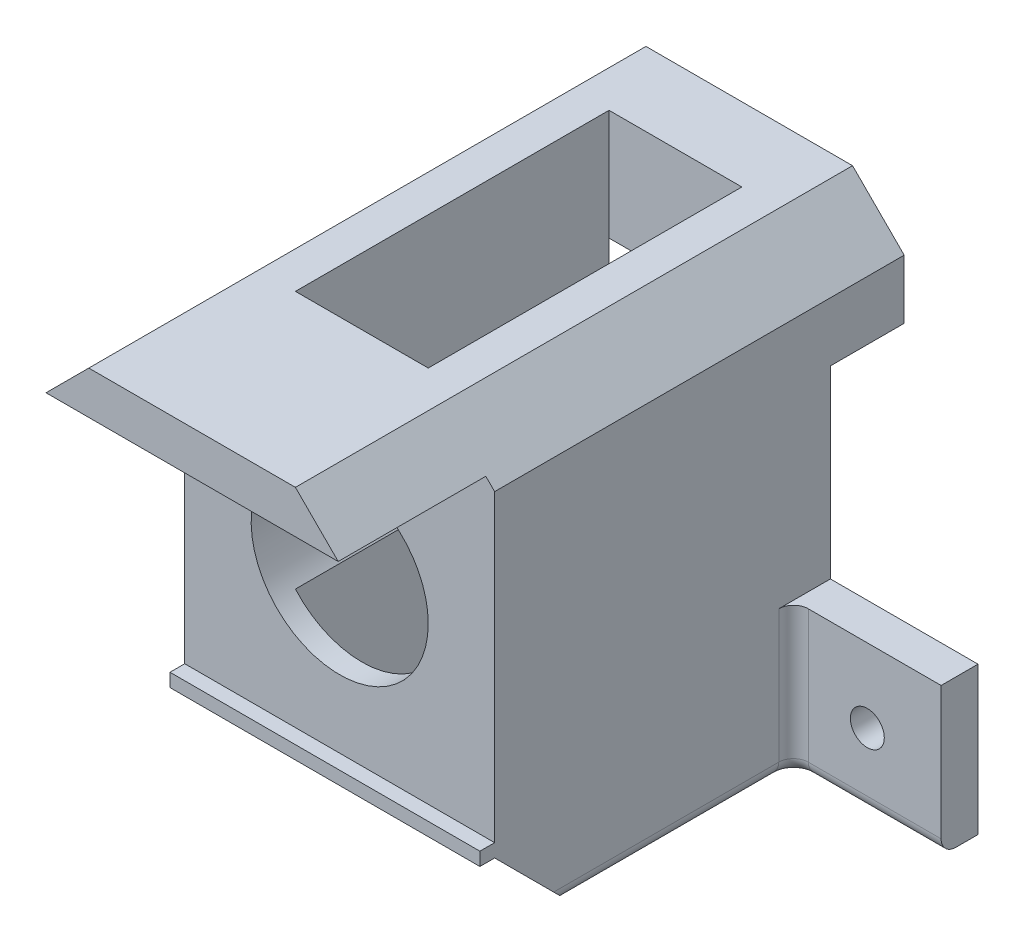
from build123d import *

# Parameters (mm, degrees)
SKETCH_1_W          = 12
SKETCH_1_H          = 60
EXTRUDE_1_DEPTH     = 42.5
EXTRUDE_1_2_DEPTH   = 42.5
SKETCH_2_W          = 42
SKETCH_2_H          = 60
SKETCH_2_R          = 12
EXTRUDE_2_DEPTH     = 3
SKETCH_3_R          = 12
CUT_EXTRUDE_1_DEPTH = 79.174484328
SKETCH_4_W          = 42
SKETCH_4_H          = 15
EXTRUDE_3_DEPTH     = 10
CHAMFER_1_SIZE      = 10
SKETCH_5_W          = 5
SKETCH_5_H          = 20
EXTRUDE_4_DEPTH     = 20
HOLE_WIZARD_M4_1_D  = 4.6
FILLET_1_R          = 2
CHAMFER_2_SIZE      = 7
EXTRUDE_5_DEPTH     = 20
SKETCH_9_W          = 42
SKETCH_9_H          = 1.8
EXTRUDE_6_DEPTH     = 2


with BuildPart() as part:
    # 스케치1 → 보스-돌출1 (new body)
    with BuildSketch(Plane.XY):
        with Locations((-15, 30)):
            Rectangle(SKETCH_1_W, SKETCH_1_H)
    extrude(amount=EXTRUDE_1_DEPTH)



with BuildPart() as body_2:
    # 스케치1 → Extrude 1 2 (new body)
    with BuildSketch(Plane.XY):
        with Locations((15, 30)):
            Rectangle(SKETCH_1_W, SKETCH_1_H)
    extrude(amount=EXTRUDE_1_2_DEPTH)


with BuildPart() as part_1:
    add(part.part)

    add(body_2.part)  # 보스-돌출2 merges body 2
    # 스케치2 → 보스-돌출2 (add)
    with BuildSketch(Plane.XY.offset(42.5)):
        with Locations((0, 30)):
            Rectangle(SKETCH_2_W, SKETCH_2_H)
        with Locations(Location((0, 33, 0), (0, 0, 138.590377891))):
            Circle(SKETCH_2_R, mode=Mode.SUBTRACT)
    extrude(amount=EXTRUDE_2_DEPTH)

    # 스케치3 → 컷-돌출1 (cut, through all)
    with BuildSketch(Plane.XY.offset(45.5)):
        with Locations(Location((0, 33, 0), (0, 0, 138.590377891))):
            Circle(SKETCH_3_R)
    extrude(amount=-CUT_EXTRUDE_1_DEPTH, mode=Mode.SUBTRACT)

    # 스케치4 → 보스-돌출3 (add)
    with BuildSketch(Plane(origin=(0, 0, 0), x_dir=(-1, 0, 0), z_dir=(0, 0, -1))):
        with Locations((0, 52.5)):
            Rectangle(SKETCH_4_W, SKETCH_4_H)
    extrude(amount=EXTRUDE_3_DEPTH)

    # 모따기1
    # the kernel refuses this chamfer: 10 mm, written as the material it takes off along each edge
    with BuildSketch(Plane(origin=(46.71682988, 0, 45.5), x_dir=(0, -0.02749587661058638, -0.9996219169112968), z_dir=(-1, 0, 0))) as chamfer_1_piece_1:
        Polygon((CHAMFER_1_SIZE * 0.999621916911, -CHAMFER_1_SIZE * 0.0274958766106), (-CHAMFER_1_SIZE * 0.0274958766106, -CHAMFER_1_SIZE * 0.999621916911), (0, 0), align=None)
    extrude(amount=93.433659759, mode=Mode.SUBTRACT)

    # 스케치5 → 보스-돌출4 (add)
    with BuildSketch(Plane(origin=(21, 0, 0), x_dir=(0, 0, -1), z_dir=(1, 0, 0))):
        with Locations((-2.5, 10)):
            Rectangle(SKETCH_5_W, SKETCH_5_H)
    extrude_4 = extrude(amount=EXTRUDE_4_DEPTH)

    # M4 여유 구멍1 (through all)
    with Locations(Plane.XY.offset(5)):
        with Locations((31, 10)):
            hole_wizard_m4_1 = Hole(HOLE_WIZARD_M4_1_D / 2)

    # 대칭 복사1: 보스-돌출4, M4 여유 구멍1 across plane
    add(extrude_4.mirror(Plane(origin=(0, 0, 0), x_dir=(0, 0, 1), z_dir=(1, 0, 0))))
    add(hole_wizard_m4_1.mirror(Plane(origin=(0, 0, 0), x_dir=(0, 0, 1), z_dir=(1, 0, 0))), mode=Mode.SUBTRACT)

    # 필렛1
    fillet_1_edges = [part_1.edges().sort_by_distance(p)[0] for p in [
        (21, 0, 20.25),
        (-21, 0, 20.25),
        (21, 10, 5),
        (31, 0, 5),
        (-31, 0, 5),
        (-21, 10, 5),
    ]]
    fillet(fillet_1_edges, radius=FILLET_1_R)

    # 모따기2
    chamfer_2_edges = [part_1.edges().sort_by_distance(p)[0] for p in [
        (21, 60, 17.75),
        (-21, 60, 17.75),
    ]]
    chamfer(chamfer_2_edges, length=CHAMFER_2_SIZE)

    # 스케치8 → 보스-돌출5 (add)
    with BuildSketch(Plane.XY.offset(45.5)):
        Polygon((-19.8, 54.2), (19.8, 54.2), (14, 60), (-14, 60), align=None)
    extrude(amount=EXTRUDE_5_DEPTH)

    # 스케치9 → 보스-돌출6 (add)
    with BuildSketch(Plane.XY.offset(45.5)):
        with Locations((0, 10.9)):
            Rectangle(SKETCH_9_W, SKETCH_9_H)
    extrude(amount=EXTRUDE_6_DEPTH)


solid = part_1.part
